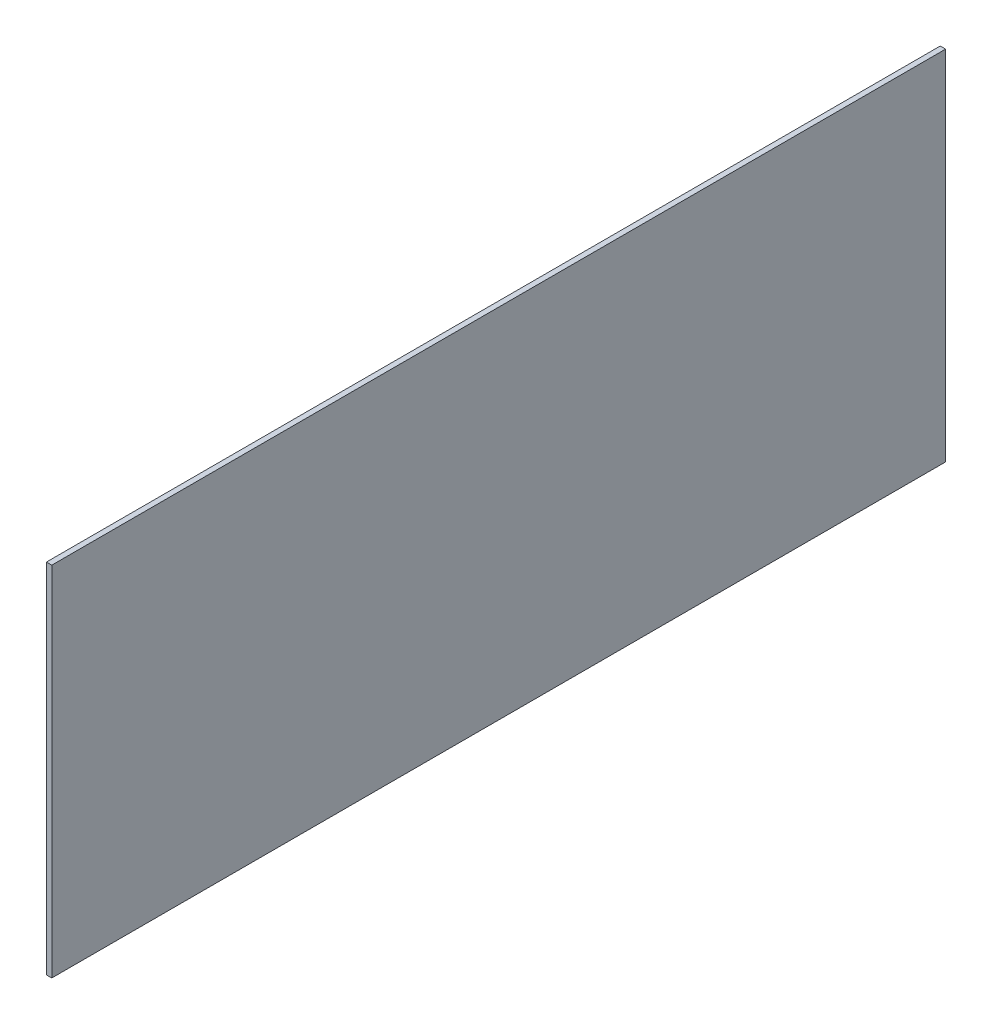
from build123d import *

# Parameters (mm, degrees)
ESBO_O1_W          = 1.2
ESBO_O1_H          = 80
FLANGE_BASE1_DEPTH = 200


# Sheet-metal steps are written as plain solids
with BuildPart() as part:
    # Esboço1 → Flange-base1 (new body)
    with BuildSketch(Plane.XY):
        with Locations((0.6, 40)):
            Rectangle(ESBO_O1_W, ESBO_O1_H)
    extrude(amount=FLANGE_BASE1_DEPTH)


solid = part.part
